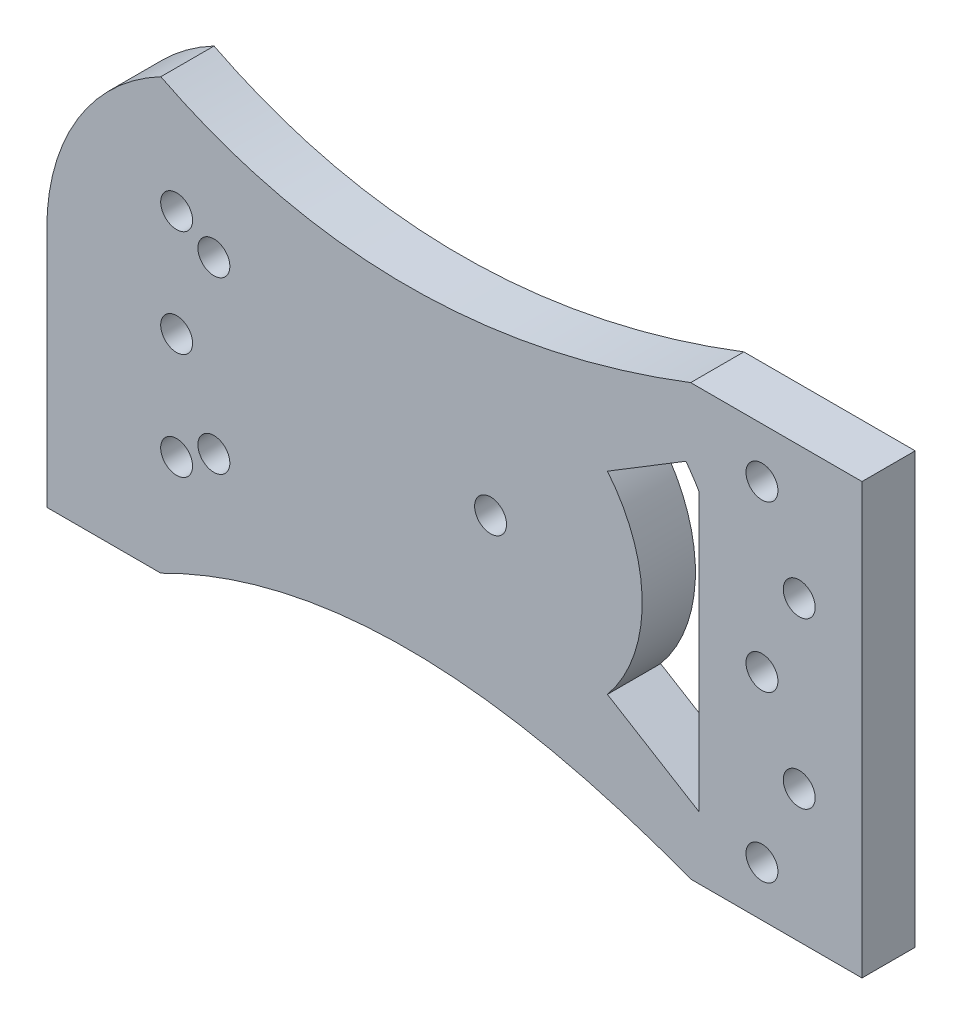
from build123d import *

# Parameters (mm, degrees)
CROQUIS1_W              = 41.4
CROQUIS1_H              = 40.4
CROQUIS1_R              = 1.5
SALIENTE_EXTRUIR1_DEPTH = 5
CROQUIS3_W              = 35.2
CROQUIS3_H              = 40.4
CROQUIS3_R              = 1.5
SALIENTE_EXTRUIR3_DEPTH = 5
CORTAR_EXTRUIR1_REACH   = 77.812
REDONDEO1_R             = 20
CORTAR_EXTRUIR2_REACH   = 77.812


with BuildPart() as part:
    # Croquis1 → Saliente-Extruir1 (new body)
    with BuildSketch(Plane.XY):
        with Locations((52.2, 0)):
            Rectangle(CROQUIS1_W, CROQUIS1_H)
        with Locations((63.5, 0)):
            Circle(CROQUIS1_R, mode=Mode.SUBTRACT)
        with Locations((63.5, -15.5)):
            Circle(CROQUIS1_R, mode=Mode.SUBTRACT)
        with Locations((38, 0)):
            Circle(CROQUIS1_R, mode=Mode.SUBTRACT)
        with Locations((63.5, 15.5)):
            Circle(CROQUIS1_R, mode=Mode.SUBTRACT)
        with Locations((67, -7.75)):
            Circle(CROQUIS1_R, mode=Mode.SUBTRACT)
        with Locations((67, 7.75)):
            Circle(CROQUIS1_R, mode=Mode.SUBTRACT)
    extrude(amount=SALIENTE_EXTRUIR1_DEPTH)

    # Croquis3 → Saliente-Extruir3 (add)
    with BuildSketch(Plane.XY.offset(5)):
        with Locations((13.9, 0)):
            Rectangle(CROQUIS3_W, CROQUIS3_H)
        with Locations((8.5, 0)):
            Circle(CROQUIS3_R, mode=Mode.SUBTRACT)
        with Locations((8.5, -10)):
            Circle(CROQUIS3_R, mode=Mode.SUBTRACT)
        with Locations((8.5, 10)):
            Circle(CROQUIS3_R, mode=Mode.SUBTRACT)
        with Locations((12, 8)):
            Circle(CROQUIS3_R, mode=Mode.SUBTRACT)
        with Locations((12, -8)):
            Circle(CROQUIS3_R, mode=Mode.SUBTRACT)
    extrude(amount=-SALIENTE_EXTRUIR3_DEPTH)

    # Croquis5 → Cortar-Extruir1 (cut, up to next)
    with BuildSketch(Plane.XY.offset(5), mode=Mode.PRIVATE) as cortar_extruir1_sk1:
        with BuildLine():
            Line((7.014997686, 20.2), (56.8, 20.2))
            add(Edge.make_bspline(
                [(56.8, 20.2), (28.469554023, 9.322898051), (7.014997686, 20.2)],
                knots=[0, 0, 0, 0.793600416, 0.793600416, 0.793600416], degree=2))
        make_face()
    cortar_extruir1_tool1 = extrude(cortar_extruir1_sk1.sketch, amount=-CORTAR_EXTRUIR1_REACH, mode=Mode.PRIVATE) & part.part
    cortar_extruir1 = cortar_extruir1_tool1.solids().sort_by_distance((31.21991, 18.02458, 5))[0]
    add(cortar_extruir1, mode=Mode.SUBTRACT)

    # Simetría1: Cortar-Extruir1 across plane
    add(cortar_extruir1.mirror(Plane.ZX), mode=Mode.SUBTRACT)

    # Redondeo1
    # the kernel refuses this fillet: 20 mm, written as the material it takes off along each edge
    with BuildSketch(Plane(origin=(-3.7, 20.2, 49.285207182), x_dir=(1, 0, 0), z_dir=(0, 0, -1))) as redondeo1_piece_1:
        with BuildLine():
            CenterArc((20, 17.714082873), REDONDEO1_R, 180, 62.338298383)
            Line((0, 17.714082873), (-0.4, 17.714082873))
            Line((-0.4, 17.714082873), (-0.4, 0))
            Line((-0.4, 0), (0, -0.4))
            ThreePointArc((0, -0.4), (5.357498843, -0.4), (10.52929764, -0.354281657))
            Line((10.52929764, -0.354281657), (10.714997686, 0))
        make_face()
    extrude(amount=93.570414364, mode=Mode.SUBTRACT)

    # Croquis6 → Cortar-Extruir2 (cut, up to next)
    with BuildSketch(Plane.XY.offset(5), mode=Mode.PRIVATE) as cortar_extruir2_sk1:
        with BuildLine():
            ThreePointArc((57.606275, 11.70586502), (57.004955729, 12.658789554), (56.35736085, 13.580890908))
            Line((56.35736085, 13.580890908), (48.977815911, 9.082196509))
            ThreePointArc((48.977815911, 9.082196509), (52.247762477, 0), (48.977815911, -9.082196509))
            Line((48.977815911, -9.082196509), (57.606275, -14.342249927))
            Line((57.606275, -14.342249927), (57.606275, 11.70586502))
        make_face()
    cortar_extruir2_tool1 = extrude(cortar_extruir2_sk1.sketch, amount=-CORTAR_EXTRUIR2_REACH, mode=Mode.PRIVATE) & part.part
    add(cortar_extruir2_tool1.solids().sort_by_distance((54.420947, -0.132696, 5))[0], mode=Mode.SUBTRACT)


solid = part.part
